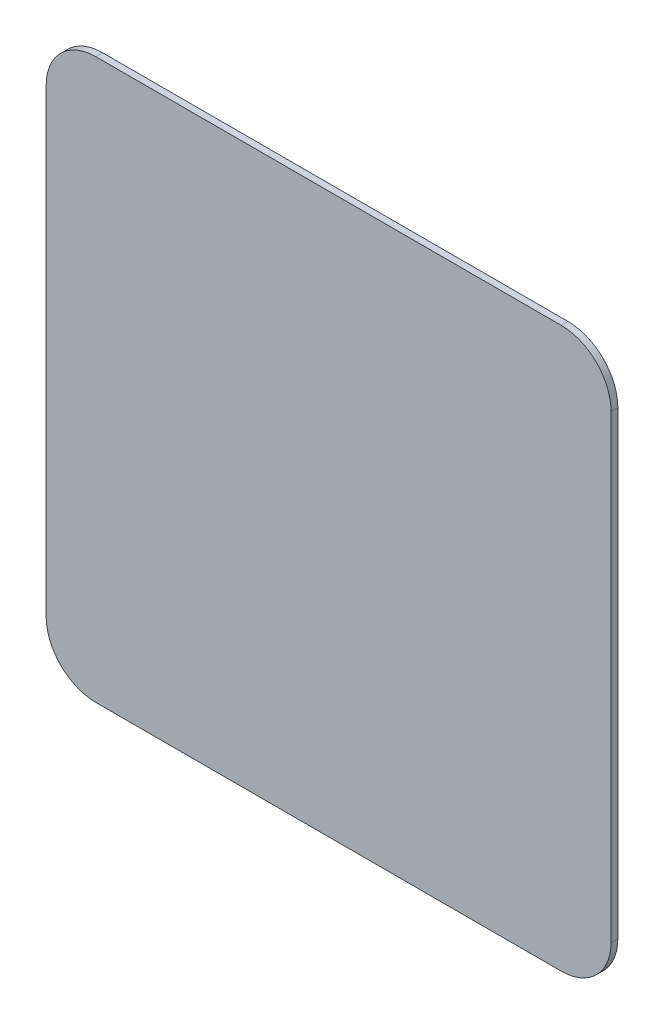
from build123d import *

# Parameters (mm, degrees)
SKETCH1_W           = 500
SKETCH1_H           = 495
BOSS_EXTRUDE1_DEPTH = 6
FILLET1_R           = 44


with BuildPart() as part:
    # Sketch1 → Boss-Extrude1 (new body)
    with BuildSketch(Plane.XY):
        with Locations((250, 247.5)):
            Rectangle(SKETCH1_W, SKETCH1_H)
    extrude(amount=BOSS_EXTRUDE1_DEPTH)

    # Fillet1
    fillet1_edges = [part.edges().sort_by_distance(p)[0] for p in [
        (0, 0, 3),
        (0, 495, 3),
        (500, 0, 3),
        (500, 495, 3),
    ]]
    fillet(fillet1_edges, radius=FILLET1_R)


solid = part.part
